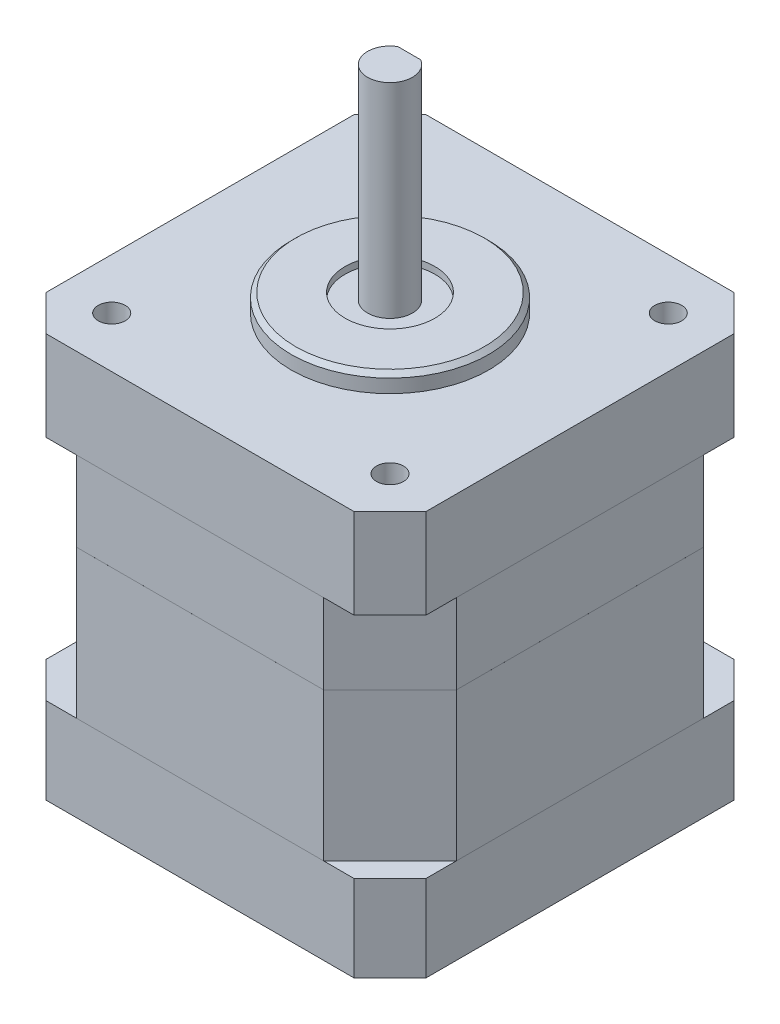
from build123d import *

# Parameters (mm, degrees)
EXTRUDE1_START       = -17
SKETCH1_W            = 42.3
SKETCH1_H            = 42.3
EXTRUDE1_DEPTH       = 9.6
CHAMFER3_SIZE        = 4
BOSS_EXTRUDE8_DEPTH  = 16.5
BOSS_EXTRUDE9_DEPTH  = 7.65
SKETCH33_R           = 11
BOSS_EXTRUDE10_DEPTH = 2
SKETCH34_R           = 5
CUT_EXTRUDE1_DEPTH   = 2
SKETCH35_R           = 2.5
BOSS_EXTRUDE11_DEPTH = 20
CUT_EXTRUDE3_START   = -15
CUT_EXTRUDE3_DEPTH   = 15
SKETCH37_W           = 27.5
SKETCH37_H           = 16.5
BOSS_EXTRUDE12_DEPTH = 0.001
SKETCH38_W           = 27.5
SKETCH38_H           = 16.5
BOSS_EXTRUDE13_DEPTH = 0.001
SKETCH39_W           = 27.5
SKETCH39_H           = 16.5
BOSS_EXTRUDE14_DEPTH = 0.001
SKETCH40_W           = 27.5
SKETCH40_H           = 16.5
BOSS_EXTRUDE15_DEPTH = 0.001
SKETCH41_R           = 1.5
CUT_EXTRUDE4_DEPTH   = 6
CUT_EXTRUDE5_START   = -3
SKETCH42_R           = 4.5
SKETCH42_R_2         = 1.5
CUT_EXTRUDE5_DEPTH   = 3
SKETCH43_W           = 16
SKETCH43_H           = 4
BOSS_EXTRUDE16_DEPTH = 3.2
SKETCH44_W           = 16
SKETCH44_H           = 6.4
BOSS_EXTRUDE17_DEPTH = 6
SKETCH45_W           = 15
SKETCH45_H           = 5.5
CUT_EXTRUDE6_DEPTH   = 5
BOSS_EXTRUDE18_START = 1.5
SKETCH46_R           = 1.5
BOSS_EXTRUDE18_DEPTH = 1.5
CHAMFER4_SIZE        = 0.4
EXTRUDE_1_DEPTH      = 15.25
SKETCH_3_R           = 2.5
EXTRUDE_2_DEPTH      = 11.25
SKETCH_4_R           = 11
SKETCH_4_R_2         = 5
EXTRUDE_3_DEPTH      = 13.25
CHAMFER_1_SIZE       = 0.5
EXTRUDE_START        = 11.25
SKETCH_5_R           = 1.5
SKETCH_5_R_2         = 11
EXTRUDE_4_DEPTH      = 11.25
CUT_EXTRUDE_1_DEPTH  = 8.9
EXTRUDE_8_DEPTH      = 8.9
SKETCH_13_R          = 1.5
SKETCH_13_R_2        = 4.5
EXTRUDE_11_DEPTH     = 8.9
SKETCH_14_R          = 3
SKETCH_14_R_2        = 4.5
CUT_EXTRUDE_4_DEPTH  = 8.9
SKETCH_15_R          = 5
EXTRUDE_12_DEPTH     = 11.25
CUT_EXTRUDE_5_REACH  = 67.505
SKETCH_16_W          = 6
SKETCH_16_H          = 9.6


with BuildPart() as part:
    # Sketch1 → Extrude1 (new body)
    with BuildSketch(Plane(origin=(0, 0, 0), x_dir=(1, 0, 0), z_dir=(0, 1, 0)).offset(EXTRUDE1_START)):
        Rectangle(SKETCH1_W, SKETCH1_H)
    extrude(amount=EXTRUDE1_DEPTH)

    # Chamfer3
    chamfer3_edges = [part.edges().sort_by_distance(p)[0] for p in [
        (21.15, -12.2, 21.15),
        (-21.15, -12.2, 21.15),
        (21.15, -12.2, -21.15),
        (-21.15, -12.2, -21.15),
    ]]
    chamfer(chamfer3_edges, length=CHAMFER3_SIZE)

    # Sketch31 → Boss-Extrude8 (add)
    with BuildSketch(Plane(origin=(0, -7.4, 0), x_dir=(1, 0, 0), z_dir=(0, 1, 0))):
        Polygon((-13.75, 21.15), (13.75, 21.15), (21.15, 13.75), (21.15, -13.75), (13.75, -21.15), (-13.75, -21.15), (-21.15, -13.75), (-21.15, 13.75), align=None)
    extrude(amount=BOSS_EXTRUDE8_DEPTH)

    # Sketch32 → Boss-Extrude9 (add)
    with BuildSketch(Plane(origin=(0, 9.1, 0), x_dir=(1, 0, 0), z_dir=(0, 1, 0))):
        Polygon((-17.15, 21.15), (-21.15, 17.15), (-21.15, 13.75), (-21.15, -13.75), (-21.15, -17.15), (-17.15, -21.15), (-13.75, -21.15), (13.75, -21.15), (17.15, -21.15), (21.15, -17.15), (21.15, -13.75), (21.15, 13.75), (21.15, 17.15), (17.15, 21.15), (13.75, 21.15), (-13.75, 21.15), align=None)
    extrude(amount=BOSS_EXTRUDE9_DEPTH)

    # Sketch33 → Boss-Extrude10 (add)
    with BuildSketch(Plane(origin=(0, 16.75, 0), x_dir=(1, 0, 0), z_dir=(0, 1, 0))):
        Circle(SKETCH33_R)
    extrude(amount=BOSS_EXTRUDE10_DEPTH)

    # Sketch34 → Cut-Extrude1 (cut)
    with BuildSketch(Plane(origin=(0, 18.75, 0), x_dir=(1, 0, 0), z_dir=(0, 1, 0))):
        Circle(SKETCH34_R)
    extrude(amount=-CUT_EXTRUDE1_DEPTH, mode=Mode.SUBTRACT)

    # Sketch35 → Boss-Extrude11 (add)
    with BuildSketch(Plane(origin=(0, 16.75, 0), x_dir=(1, 0, 0), z_dir=(0, 1, 0))):
        Circle(SKETCH35_R)
    extrude(amount=BOSS_EXTRUDE11_DEPTH)

    # Sketch36 → Cut-Extrude3 (cut)
    with BuildSketch(Plane(origin=(0, 36.75, 0), x_dir=(1, 0, 0), z_dir=(0, 1, 0)).offset(CUT_EXTRUDE3_START)):
        with BuildLine():
            Line((-1.275735082, 2.15), (0, 2.15))
            Line((0, 2.15), (1.275735082, 2.15))
            ThreePointArc((1.275735082, 2.15), (0, 2.5), (-1.275735082, 2.15))
        make_face()
    extrude(amount=CUT_EXTRUDE3_DEPTH, mode=Mode.SUBTRACT)

    # Sketch37 → Boss-Extrude12 (add)
    with BuildSketch(Plane(origin=(21.15, 0, 0), x_dir=(0, 0, -1), z_dir=(1, 0, 0))):
        with Locations((0, 0.85)):
            Rectangle(SKETCH37_W, SKETCH37_H)
    extrude(amount=BOSS_EXTRUDE12_DEPTH)

    # Sketch38 → Boss-Extrude13 (add)
    with BuildSketch(Plane.XY.offset(21.15)):
        with Locations((0, 0.85)):
            Rectangle(SKETCH38_W, SKETCH38_H)
    extrude(amount=BOSS_EXTRUDE13_DEPTH)

    # Sketch39 → Boss-Extrude14 (add)
    with BuildSketch(Plane.ZY.offset(21.15)):
        with Locations((0, 0.85)):
            Rectangle(SKETCH39_W, SKETCH39_H)
    extrude(amount=BOSS_EXTRUDE14_DEPTH)

    # Sketch40 → Boss-Extrude15 (add)
    with BuildSketch(Plane(origin=(0, 0, -21.15), x_dir=(-1, 0, 0), z_dir=(0, 0, -1))):
        with Locations((0, 0.85)):
            Rectangle(SKETCH40_W, SKETCH40_H)
    extrude(amount=BOSS_EXTRUDE15_DEPTH)

    # Sketch41 → Cut-Extrude4 (cut)
    with BuildSketch(Plane(origin=(0, 16.75, 0), x_dir=(1, 0, 0), z_dir=(0, 1, 0))):
        with Locations((-15.5, 15.5)):
            Circle(SKETCH41_R)
        with Locations((-15.5, -15.5)):
            Circle(SKETCH41_R)
        with Locations((15.5, -15.5)):
            Circle(SKETCH41_R)
        with Locations((15.5, 15.5)):
            Circle(SKETCH41_R)
    extrude(amount=-CUT_EXTRUDE4_DEPTH, mode=Mode.SUBTRACT)

    # Sketch42 → Cut-Extrude5 (cut)
    with BuildSketch(Plane.XZ.offset(17).offset(CUT_EXTRUDE5_START)):
        Circle(SKETCH42_R)
        with Locations((-15.5, 15.5)):
            Circle(SKETCH42_R_2)
        with Locations((15.5, 15.5)):
            Circle(SKETCH42_R_2)
        with Locations((15.5, -15.5)):
            Circle(SKETCH42_R_2)
        with Locations((-15.5, -15.5)):
            Circle(SKETCH42_R_2)
    extrude(amount=CUT_EXTRUDE5_DEPTH, mode=Mode.SUBTRACT)

    # Sketch43 → Boss-Extrude16 (add)
    with BuildSketch(Plane.XZ.offset(17)):
        with Locations((0, 23.15)):
            Rectangle(SKETCH43_W, SKETCH43_H)
    extrude(amount=-BOSS_EXTRUDE16_DEPTH)

    # Sketch44 → Boss-Extrude17 (add)
    with BuildSketch(Plane.XY.offset(21.15)):
        with Locations((0, -10.6)):
            Rectangle(SKETCH44_W, SKETCH44_H)
    extrude(amount=BOSS_EXTRUDE17_DEPTH)

    # Sketch45 → Cut-Extrude6 (cut)
    with BuildSketch(Plane.XY.offset(27.15)):
        with Locations((0, -10.65)):
            Rectangle(SKETCH45_W, SKETCH45_H)
    extrude(amount=-CUT_EXTRUDE6_DEPTH, mode=Mode.SUBTRACT)

    # Sketch46 → Boss-Extrude18 (add)
    with BuildSketch(Plane(origin=(0, 10.75, 0), x_dir=(1, 0, 0), z_dir=(0, 1, 0)).offset(BOSS_EXTRUDE18_START)):
        with Locations((-15.5, -15.5)):
            Circle(SKETCH46_R)
        with Locations((-15.5, 15.5)):
            Circle(SKETCH46_R)
        with Locations((15.5, 15.5)):
            Circle(SKETCH46_R)
        with Locations((15.5, -15.5)):
            Circle(SKETCH46_R)
    extrude(amount=-BOSS_EXTRUDE18_DEPTH)

    # Chamfer4
    chamfer4_edges = [part.edges().sort_by_distance(p)[0] for p in [
        (-11, 18.75, 0),
    ]]
    chamfer(chamfer4_edges, length=CHAMFER4_SIZE)

    # 草图2 → 凸台-拉伸1 (add)
    with BuildSketch(Plane(origin=(0, 36.75, 0), x_dir=(1, 0, 0), z_dir=(0, 1, 0))):
        with BuildLine():
            Line((1.275735082, 2.15), (-1.275735082, 2.15))
            ThreePointArc((-1.275735082, 2.15), (-1.237065539, -2.172479885), (2.5, 0))
            ThreePointArc((2.5, 0), (2.172479885, 1.237065539), (1.275735082, 2.15))
        make_face()
    extrude(amount=EXTRUDE_1_DEPTH)

    # 草图3 → 凸台-拉伸2 (add)
    with BuildSketch(Plane(origin=(0, 21.75, 0), x_dir=(1, 0, 0), z_dir=(0, 1, 0))):
        Circle(SKETCH_3_R)
    extrude(amount=EXTRUDE_2_DEPTH)

    # 草图4 → 凸台-拉伸3 (add)
    with BuildSketch(Plane(origin=(0, 16.75, 0), x_dir=(1, 0, 0), z_dir=(0, 1, 0))):
        Circle(SKETCH_4_R)
        Circle(SKETCH_4_R_2, mode=Mode.SUBTRACT)
    extrude(amount=EXTRUDE_3_DEPTH)

    # 倒角1
    chamfer_1_edges = [part.edges().sort_by_distance(p)[0] for p in [
        (-11, 30, 0),
    ]]
    chamfer(chamfer_1_edges, length=CHAMFER_1_SIZE)

    # 草图5 → 凸台-拉伸4 (add)
    with BuildSketch(Plane(origin=(0, 16.75, 0), x_dir=(1, 0, 0), z_dir=(0, 1, 0)).offset(EXTRUDE_START)):
        Polygon((-21.15, -17.15), (-17.15, -21.15), (17.15, -21.15), (21.15, -17.15), (21.15, 17.15), (17.15, 21.15), (-17.15, 21.15), (-21.15, 17.15), align=None)
        with Locations((-15.5, -15.5)):
            Circle(SKETCH_5_R, mode=Mode.SUBTRACT)
        with Locations((15.5, -15.5)):
            Circle(SKETCH_5_R, mode=Mode.SUBTRACT)
        with Locations((15.5, 15.5)):
            Circle(SKETCH_5_R, mode=Mode.SUBTRACT)
        with Locations((-15.5, 15.5)):
            Circle(SKETCH_5_R, mode=Mode.SUBTRACT)
        Circle(SKETCH_5_R_2, mode=Mode.SUBTRACT)
    extrude(amount=-EXTRUDE_4_DEPTH)

    # 草图8 → 切除-拉伸1 (cut)
    with BuildSketch(Plane.XZ.offset(-9.1)):
        Polygon((-17.15, 21.15), (-21.15, 17.15), (-21.15, -17.15), (-17.15, -21.15), (17.15, -21.15), (21.15, -17.15), (21.15, 17.15), (17.15, 21.15), align=None)
    extrude(amount=-CUT_EXTRUDE_1_DEPTH, mode=Mode.SUBTRACT)


with BuildPart() as cut_extrude_1_piece_1:
    # of the separate pieces the step leaves, piece 1, a body of its own (cut_extrude_1_pieces)
    add(part.part.solids().sort_by_distance((-21.15, 9.1, -13.75))[0])



with BuildPart() as cut_extrude_1_piece_2:
    # of the separate pieces the step leaves, piece 2, a body of its own (cut_extrude_1_pieces)
    add(part.part.solids().sort_by_distance((11, 29.5, 0))[0])


with BuildPart() as cut_extrude_1_piece_3:
    # of the separate pieces the step leaves, piece 3, a body of its own (cut_extrude_1_pieces)
    add(part.part.solids().sort_by_distance((2.5, 18, 0))[0])


with BuildPart() as cut_extrude_1_piece_1_1:
    add(cut_extrude_1_piece_1.part)

    add(cut_extrude_1_piece_2.part)  # 凸台-拉伸8 merges 切除-拉伸1 piece 2

    add(cut_extrude_1_piece_3.part)  # 凸台-拉伸8 merges 切除-拉伸1 piece 3
    # 草图12 → 凸台-拉伸8 (add)
    with BuildSketch(Plane(origin=(0, 9.1, 0), x_dir=(1, 0, 0), z_dir=(0, 1, 0))):
        Polygon((21.15, -13.75), (13.75, -21.151), (-13.75, -21.15), (-21.15, -13.75), (-21.151, 13.75), (-13.75, 21.15), (13.75, 21.151), (21.151, 13.75), align=None)
    extrude(amount=EXTRUDE_8_DEPTH)

    # 草图13 → 凸台-拉伸11 (add)
    with BuildSketch(Plane.XZ.offset(17)):
        with Locations((-15.5, 15.5)):
            Circle(SKETCH_13_R)
        with Locations((15.5, 15.5)):
            Circle(SKETCH_13_R)
        Circle(SKETCH_13_R_2)
        with Locations((-15.5, -15.5)):
            Circle(SKETCH_13_R)
        with Locations((15.5, -15.5)):
            Circle(SKETCH_13_R)
    extrude(amount=-EXTRUDE_11_DEPTH)

    # 草图14 → 切除-拉伸4 (cut)
    with BuildSketch(Plane.XZ.offset(17)):
        with Locations((15, 15)):
            Circle(SKETCH_14_R)
        with Locations((15, -15)):
            Circle(SKETCH_14_R)
        with Locations((-15, -15)):
            Circle(SKETCH_14_R)
        with Locations((-15, 15)):
            Circle(SKETCH_14_R)
        Circle(SKETCH_14_R_2)
    extrude(amount=-CUT_EXTRUDE_4_DEPTH, mode=Mode.SUBTRACT)

    # 草图15 → 凸台-拉伸12 (add)
    with BuildSketch(Plane(origin=(0, 18, 0), x_dir=(1, 0, 0), z_dir=(0, 1, 0))):
        Circle(SKETCH_15_R)
    extrude(amount=EXTRUDE_12_DEPTH)

    # 草图16 → 切除-拉伸5 (cut, up to next)
    with BuildSketch(Plane.ZY.offset(8), mode=Mode.PRIVATE) as cut_extrude_5_sk1:
        with Locations((24.15, -12.2)):
            Rectangle(SKETCH_16_W, SKETCH_16_H)
    cut_extrude_5_tool1 = extrude(cut_extrude_5_sk1.sketch, amount=-CUT_EXTRUDE_5_REACH, mode=Mode.PRIVATE) & cut_extrude_1_piece_1_1.part
    add(cut_extrude_5_tool1.solids().sort_by_distance((-8, -12.2, 24.15))[0], mode=Mode.SUBTRACT)


solid = cut_extrude_1_piece_1_1.part
